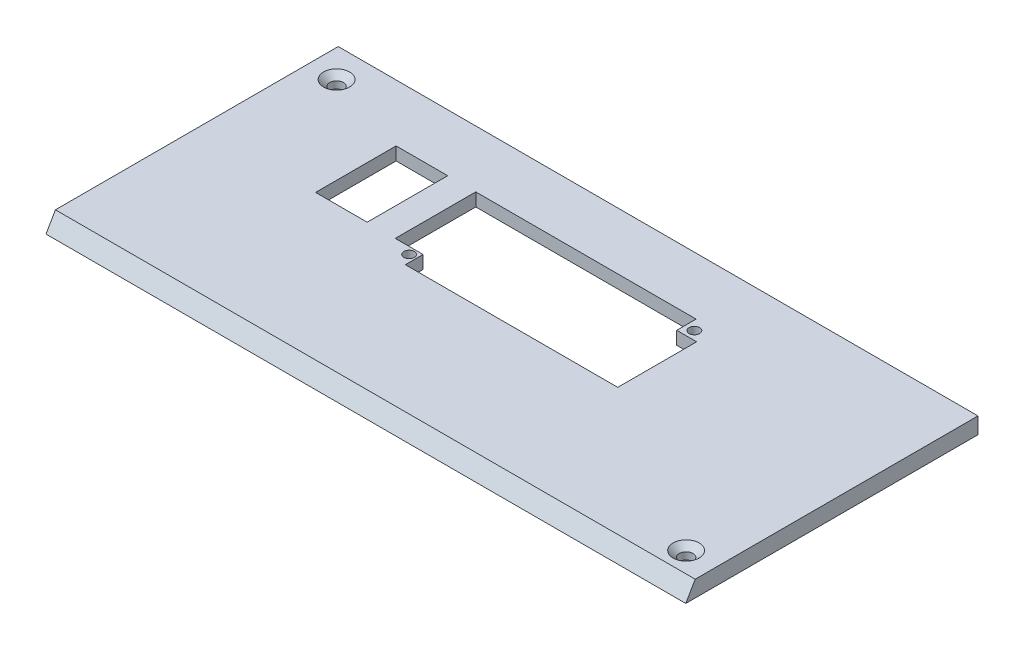
from build123d import *

# Parameters (mm, degrees)
SALIENTE_EXTRUIR1_DEPTH                              = 196
VACIADO1_T                                           = -4
SKETCH2_R                                            = 1.6
CUT_EXTRUDE1_DEPTH                                   = 4.9
SKETCH3_W                                            = 15.808220794
SKETCH3_H                                            = 24.667910986
CUT_EXTRUDE2_DEPTH                                   = 10
SKETCH4_R                                            = 1.585
CUT_EXTRUDE3_DEPTH                                   = 13
AVELLANADO_PARA_TORNILLO_CON_CABEZA_AVEL_D           = 4.2
AVELLANADO_PARA_TORNILLO_CON_CABEZA_AVEL_DEPTH       = 10
AVELLANADO_PARA_TORNILLO_CON_CABEZA_AVEL_CSINK_D     = 8
AVELLANADO_PARA_TORNILLO_CON_CABEZA_AVEL_CSINK_ANGLE = 92
AVELLANADO_PARA_TORNILLO_CON_CABEZA_AVEL_TIP         = 1.2618073


with BuildPart() as part:
    # Croquis1 → Saliente-Extruir1 (new body)
    with BuildSketch(Plane(origin=(0, 0, 0), x_dir=(0, 0, -1), z_dir=(1, 0, 0))):
        Polygon((0, 0), (89.52, 0), (89.52, 5), (2.886751346, 5), align=None)
    extrude(amount=SALIENTE_EXTRUIR1_DEPTH)

    # Vaciado1
    vaciado1_openings = [part.faces().sort_by_distance(p)[0] for p in [
        (98, 0, -44.76),
    ]]
    offset(amount=VACIADO1_T, openings=vaciado1_openings, kind=Kind.INTERSECTION)

    # Sketch2 → Cut-Extrude1 (cut)
    with BuildSketch(Plane(origin=(0, 1, 0), x_dir=(-1, 0, 0), z_dir=(0, -1, 0))):
        with Locations((-66.016866124, 45.223012087)):
            Circle(SKETCH2_R)
        with Locations((-129.916866124, 68.723012087)):
            Circle(SKETCH2_R)
        Polygon((-59.63721676, 47.355101101), (-68.161474477, 47.355101101), (-68.161474477, 41.923012087), (-133.236866124, 41.923012087), (-133.236866124, 66.093328063), (-127.135158107, 66.093328063), (-127.135158107, 72.023012087), (-59.63721676, 72.023012087), align=None)
    extrude(amount=-CUT_EXTRUDE1_DEPTH, mode=Mode.SUBTRACT)

    # Sketch3 → Cut-Extrude2 (cut)
    with BuildSketch(Plane(origin=(0, 5, 0), x_dir=(1, 0, 0), z_dir=(0, 1, 0))):
        with Locations((43.138366532, 59.689056594)):
            Rectangle(SKETCH3_W, SKETCH3_H)
    extrude(amount=-CUT_EXTRUDE2_DEPTH, mode=Mode.SUBTRACT)

    # Sketch4 → Cut-Extrude3 (cut)
    with BuildSketch(Plane(origin=(0, 1, 0), x_dir=(-1, 0, 0), z_dir=(0, -1, 0))):
        with Locations((-8.5, 80.52)):
            Circle(SKETCH4_R)
        with Locations((-187, 9.110852167)):
            Circle(SKETCH4_R)
    extrude(amount=-CUT_EXTRUDE3_DEPTH, mode=Mode.SUBTRACT)

    # Avellanado para tornillo con cabeza avellanada en cruz de M3.51
    with Locations(Plane(origin=(187, 5, -9.110852167), x_dir=(0, 0, 1), z_dir=(0, 1, 0))):
        with Locations((0, 0), (-71.409147833, -178.5)):
            CounterSinkHole(AVELLANADO_PARA_TORNILLO_CON_CABEZA_AVEL_D / 2, AVELLANADO_PARA_TORNILLO_CON_CABEZA_AVEL_CSINK_D / 2, depth=AVELLANADO_PARA_TORNILLO_CON_CABEZA_AVEL_DEPTH, counter_sink_angle=AVELLANADO_PARA_TORNILLO_CON_CABEZA_AVEL_CSINK_ANGLE)
            with Locations((0, 0, -(AVELLANADO_PARA_TORNILLO_CON_CABEZA_AVEL_DEPTH + AVELLANADO_PARA_TORNILLO_CON_CABEZA_AVEL_TIP / 2))):  # 118° drill point
                Cone(0, AVELLANADO_PARA_TORNILLO_CON_CABEZA_AVEL_D / 2, AVELLANADO_PARA_TORNILLO_CON_CABEZA_AVEL_TIP, mode=Mode.SUBTRACT)


solid = part.part
